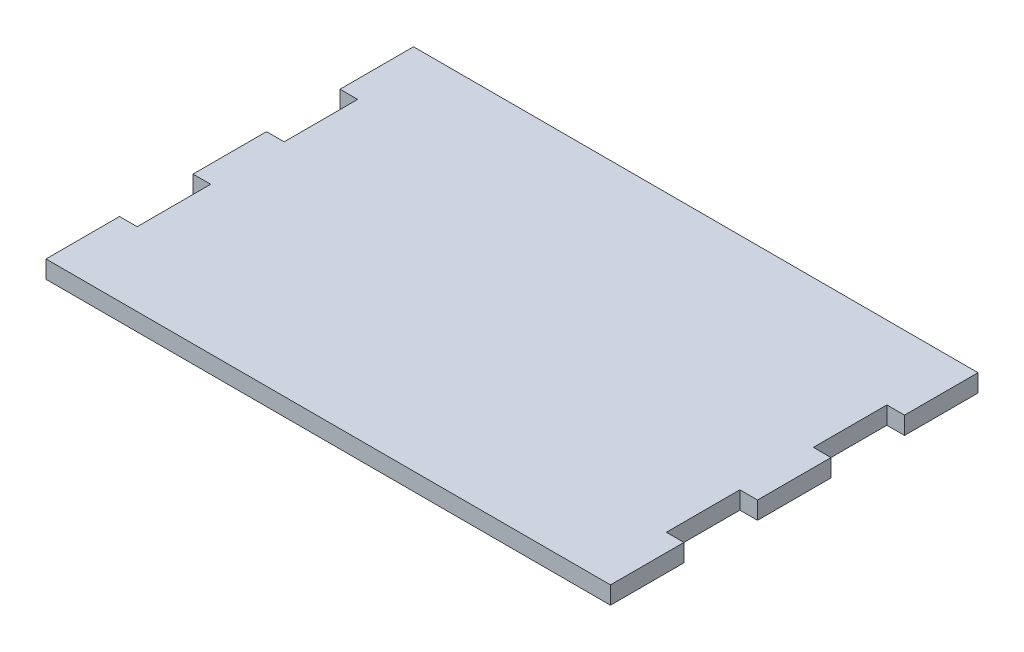
from build123d import *

# Parameters (mm, degrees)
SKETCH3_W           = 192
SKETCH3_H           = 125
BOSS_EXTRUDE1_DEPTH = 6
CUT_EXTRUDE1_DEPTH  = 6


with BuildPart() as part:
    # Sketch3 → Boss-Extrude1 (new body)
    with BuildSketch(Plane(origin=(0, 0, 0), x_dir=(1, 0, 0), z_dir=(0, 1, 0))):
        with Locations((90, 51.5)):
            Rectangle(SKETCH3_W, SKETCH3_H)
    extrude(amount=BOSS_EXTRUDE1_DEPTH)

    # Sketch4 → Cut-Extrude1 (cut)
    with BuildSketch(Plane(origin=(0, 0, 0), x_dir=(1, 0, 0), z_dir=(0, 1, 0))):
        Polygon((-6, 114), (-6, 89), (0, 89), (0, 64), (-6, 64), (-6, 39), (0, 39), (0, 14), (-6, 14), (-6, -11), (-10, -11), (-10, 114), align=None)
        Polygon((190, 114), (186, 114), (186, 89), (180, 89), (180, 64), (186, 64), (186, 39), (180, 39), (180, 14), (186, 14), (186, -11), (190, -11), align=None)
    extrude(amount=CUT_EXTRUDE1_DEPTH, mode=Mode.SUBTRACT)


solid = part.part
